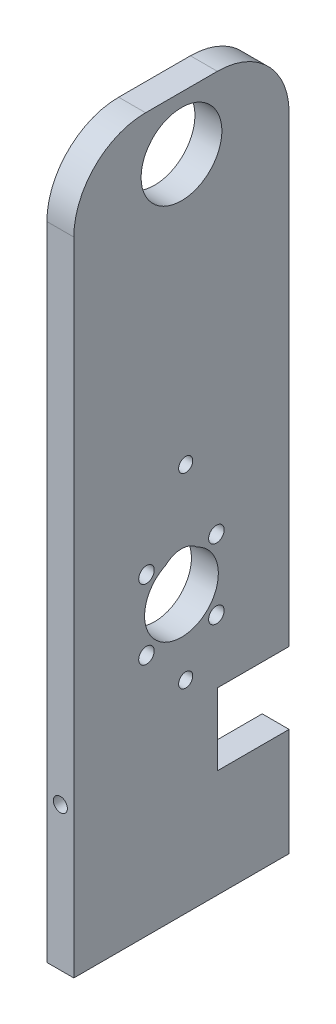
from build123d import *

# Parameters (mm, degrees)
SKETCH1_W                   = 9.525
SKETCH1_H                   = 76.2
BOSS_EXTRUDE1_DEPTH         = 126.238
SKETCH3_R                   = 14.2875
SKETCH3_R_2                 = 2.75
SKETCH3_R_3                 = 13.0556
CUT_EXTRUDE2_DEPTH          = 45.974
FILLET1_R                   = 25.4
SKETCH4_R                   = 2.499999953
SKETCH4_R_2                 = 7.9248
CUT_EXTRUDE3_DEPTH          = 133.205780014
SKETCH5_W                   = 25.4
SKETCH5_H                   = 25.4
CUT_EXTRUDE4_DEPTH          = 133.205780014
TAP_DRILL_FOR_M6X1_0_TAP1_D = 5


with BuildPart() as part:
    # Sketch1 → Boss-Extrude1 (new, symmetric)
    with BuildSketch(Plane(origin=(0, 0, 0), x_dir=(1, 0, 0), z_dir=(0, 1, 0))):
        Rectangle(SKETCH1_W, SKETCH1_H)
    extrude(amount=BOSS_EXTRUDE1_DEPTH, both=True)

    # Sketch3 → Cut-Extrude2 (cut)
    with BuildSketch(Plane.ZY.offset(4.7625)):
        with Locations((0, 107.188)):
            Circle(SKETCH3_R)
        with Locations((-12.365845519, -15.443650505)):
            Circle(SKETCH3_R_2)
        with Locations((12.374792935, -15.443650505)):
            Circle(SKETCH3_R_2)
        with Locations((-12.365845519, -40.187792935)):
            Circle(SKETCH3_R_2)
        with Locations((12.374792935, -40.187792935)):
            Circle(SKETCH3_R_2)
        with Locations((0, -27.813)):
            Circle(SKETCH3_R_3)
    extrude(amount=-CUT_EXTRUDE2_DEPTH, mode=Mode.SUBTRACT)

    # Fillet1
    fillet1_edges = [part.edges().sort_by_distance(p)[0] for p in [
        (0, 126.238, 38.1),
        (0, 126.238, -38.1),
    ]]
    fillet(fillet1_edges, radius=FILLET1_R)

    # Sketch4 → Cut-Extrude3 (cut, through all)
    with BuildSketch(Plane.ZY.offset(4.7625)):
        with Locations((-1.500000048, 11.312372418)):
            Circle(SKETCH4_R)
        with Locations((-1.500000048, -54.687627662)):
            Circle(SKETCH4_R)
        with Locations((0, -21.687627622)):
            Circle(SKETCH4_R_2)
    extrude(amount=-CUT_EXTRUDE3_DEPTH, mode=Mode.SUBTRACT)

    # Sketch5 → Cut-Extrude4 (cut, through all)
    with BuildSketch(Plane.ZY.offset(4.7625)):
        with Locations((-25.4, -75.438)):
            Rectangle(SKETCH5_W, SKETCH5_H)
    extrude(amount=-CUT_EXTRUDE4_DEPTH, mode=Mode.SUBTRACT)

    # Tap Drill for M6x1.0 Tap1 (through all)
    with Locations(Plane(origin=(0, 0, -12.7), x_dir=(-1, 0, 0), z_dir=(0, 0, -1))):
        with Locations((0, -75.438)):
            Hole(TAP_DRILL_FOR_M6X1_0_TAP1_D / 2)


solid = part.part
